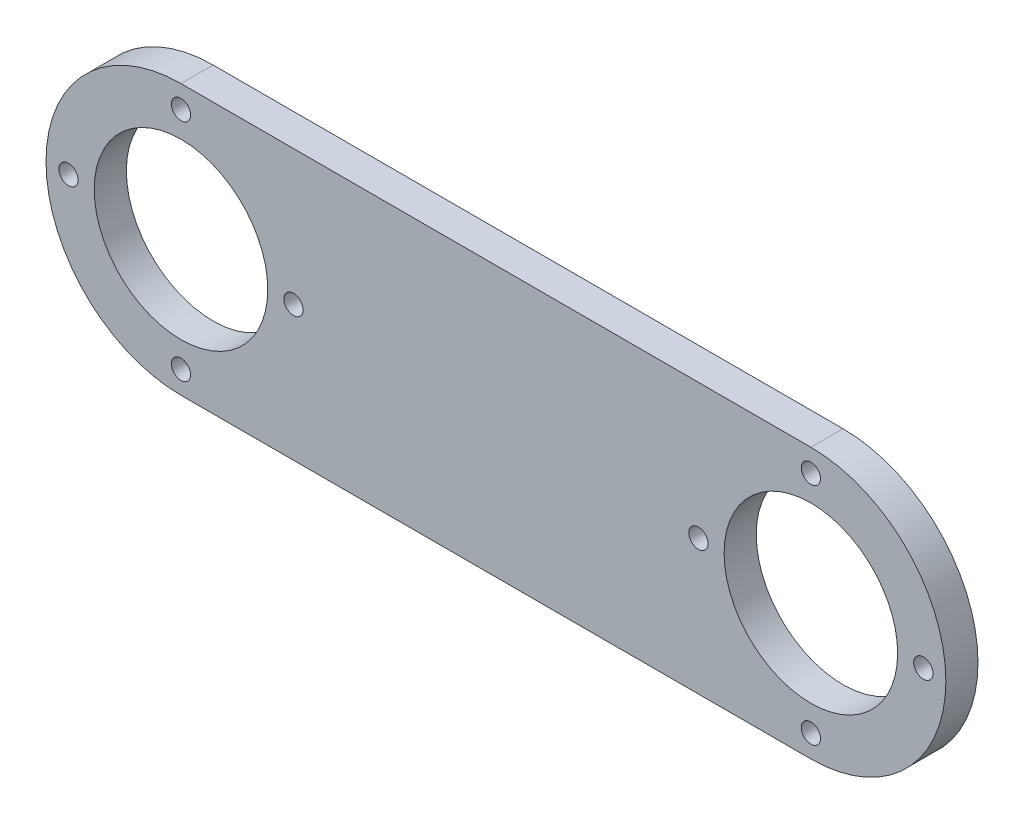
from build123d import *

# Parameters (mm, degrees)
SKETCH1_R           = 13
SKETCH1_R_2         = 1.5
BOSS_EXTRUDE1_DEPTH = 5
SKETCH2_R           = 13.5
CUT_EXTRUDE1_DEPTH  = 10


with BuildPart() as part:
    # Sketch1 → Boss-Extrude1 (new body)
    with BuildSketch(Plane.XY):
        with BuildLine():
            Line((49, 26), (-49, 26))
            ThreePointArc((-49, 26), (-70, 5), (-49, -16))
            Line((-49, -16), (49, -16))
            ThreePointArc((49, -16), (70, 5), (49, 26))
        make_face()
        with Locations((-49, 5)):
            Circle(SKETCH1_R, mode=Mode.SUBTRACT)
        with Locations((-66.5, 5)):
            Circle(SKETCH1_R_2, mode=Mode.SUBTRACT)
        with Locations((-49, 22.5)):
            Circle(SKETCH1_R_2, mode=Mode.SUBTRACT)
        with Locations((-31.5, 5)):
            Circle(SKETCH1_R_2, mode=Mode.SUBTRACT)
        with Locations((-49, -12.5)):
            Circle(SKETCH1_R_2, mode=Mode.SUBTRACT)
        with Locations((49, 5)):
            Circle(SKETCH1_R, mode=Mode.SUBTRACT)
        with Locations((31.5, 5)):
            Circle(SKETCH1_R_2, mode=Mode.SUBTRACT)
        with Locations((49, 22.5)):
            Circle(SKETCH1_R_2, mode=Mode.SUBTRACT)
        with Locations((66.5, 5)):
            Circle(SKETCH1_R_2, mode=Mode.SUBTRACT)
        with Locations((49, -12.5)):
            Circle(SKETCH1_R_2, mode=Mode.SUBTRACT)
    extrude(amount=BOSS_EXTRUDE1_DEPTH)

    # Sketch2 → Cut-Extrude1 (cut)
    with BuildSketch(Plane(origin=(0, 0, 0), x_dir=(-1, 0, 0), z_dir=(0, 0, -1))):
        with Locations((-49, 5)):
            Circle(SKETCH2_R)
        with Locations((49, 5)):
            Circle(SKETCH2_R)
    extrude(amount=-CUT_EXTRUDE1_DEPTH, mode=Mode.SUBTRACT)


solid = part.part
